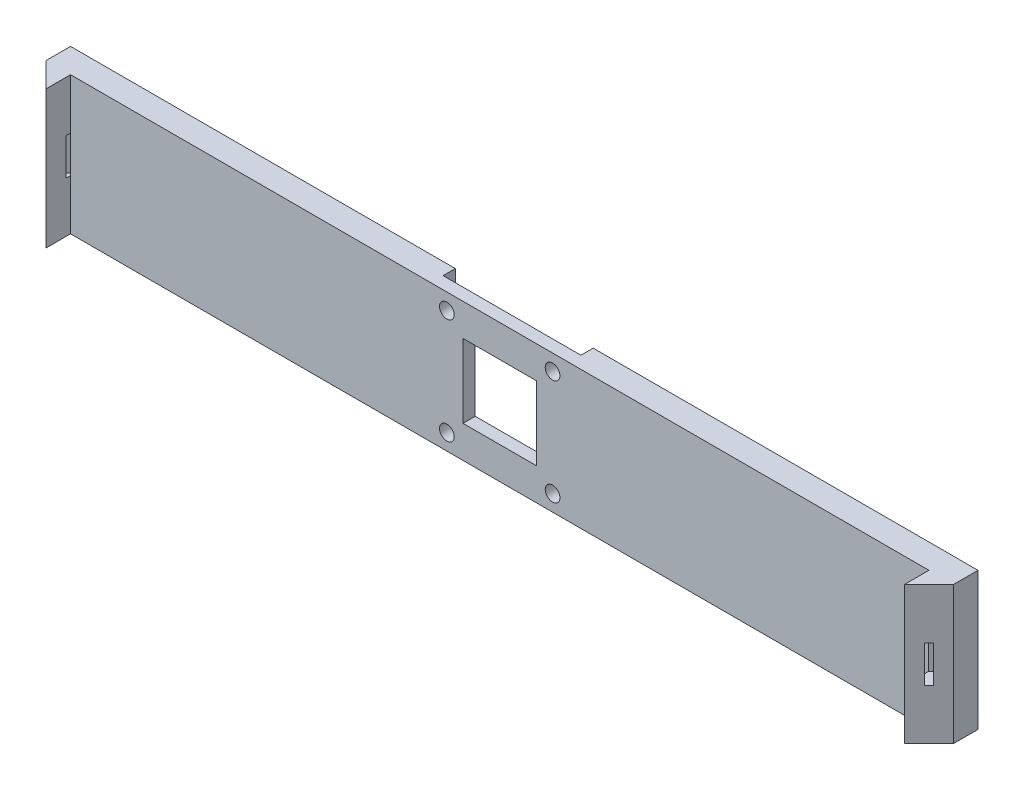
from build123d import *

# Parameters (mm, degrees)
SKETCH1_W           = 350
SKETCH1_H           = 56.2
BOSS_EXTRUDE1_DEPTH = 10
SKETCH2_W           = 56.2
SKETCH2_H           = 56.2
CUT_EXTRUDE1_DEPTH  = 5
SKETCH3_W           = 10
SKETCH3_H           = 56.2
BOSS_EXTRUDE2_DEPTH = 10
SKETCH4_W           = 10
SKETCH4_H           = 56.2
BOSS_EXTRUDE3_DEPTH = 10
CUT_EXTRUDE2_DEPTH  = 56.2
SKETCH6_W           = 10
SKETCH6_H           = 56.2
BOSS_EXTRUDE4_DEPTH = 10
SKETCH7_W           = 10
SKETCH7_H           = 56.2
BOSS_EXTRUDE5_DEPTH = 10
CUT_EXTRUDE3_DEPTH  = 56.2
SKETCH9_W           = 30
SKETCH9_H           = 30
CUT_EXTRUDE4_DEPTH  = 5
SKETCH10_R          = 3
CUT_EXTRUDE5_DEPTH  = 5
SKETCH11_W          = 2.5
SKETCH11_H          = 15
CUT_EXTRUDE6_DEPTH  = 7
SKETCH12_W          = 2.5
SKETCH12_H          = 15
CUT_EXTRUDE8_DEPTH  = 7
BOSS_EXTRUDE7_START = 5
SKETCH14_W          = 56.2
SKETCH14_H          = 56.2
SKETCH14_R          = 3
SKETCH14_W_2        = 30
SKETCH14_H_2        = 30
BOSS_EXTRUDE7_DEPTH = 5
SKETCH15_W          = 56.2
SKETCH15_H          = 56.2
CUT_EXTRUDE9_DEPTH  = 5


with BuildPart() as part:
    # Sketch1 → Boss-Extrude1 (new body)
    with BuildSketch(Plane.XY):
        Rectangle(SKETCH1_W, SKETCH1_H)
    extrude(amount=BOSS_EXTRUDE1_DEPTH)

    # Sketch2 → Cut-Extrude1 (cut)
    with BuildSketch(Plane.XY.offset(10)):
        Rectangle(SKETCH2_W, SKETCH2_H)
    extrude(amount=-CUT_EXTRUDE1_DEPTH, mode=Mode.SUBTRACT)

    # Sketch3 → Boss-Extrude2 (add)
    with BuildSketch(Plane(origin=(175, 0, 0), x_dir=(0, 0, -1), z_dir=(1, 0, 0))):
        with Locations((-5, 0)):
            Rectangle(SKETCH3_W, SKETCH3_H)
    extrude(amount=BOSS_EXTRUDE2_DEPTH)

    # Sketch4 → Boss-Extrude3 (add)
    with BuildSketch(Plane.XY.offset(10)):
        with Locations((180, 0)):
            Rectangle(SKETCH4_W, SKETCH4_H)
    extrude(amount=BOSS_EXTRUDE3_DEPTH)

    # Sketch5 → Cut-Extrude2 (cut)
    with BuildSketch(Plane(origin=(0, 28.1, 0), x_dir=(1, 0, 0), z_dir=(0, 1, 0))):
        Polygon((175, -20), (185, -10), (185, -20), align=None)
    extrude(amount=-CUT_EXTRUDE2_DEPTH, mode=Mode.SUBTRACT)

    # Sketch6 → Boss-Extrude4 (add)
    with BuildSketch(Plane.ZY.offset(175)):
        with Locations((5, 0)):
            Rectangle(SKETCH6_W, SKETCH6_H)
    extrude(amount=BOSS_EXTRUDE4_DEPTH)

    # Sketch7 → Boss-Extrude5 (add)
    with BuildSketch(Plane.XY.offset(10)):
        with Locations((-180, 0)):
            Rectangle(SKETCH7_W, SKETCH7_H)
    extrude(amount=BOSS_EXTRUDE5_DEPTH)

    # Sketch8 → Cut-Extrude3 (cut)
    with BuildSketch(Plane(origin=(0, 28.1, 0), x_dir=(1, 0, 0), z_dir=(0, 1, 0))):
        Polygon((-175, -20), (-185, -10), (-185, -20), align=None)
    extrude(amount=-CUT_EXTRUDE3_DEPTH, mode=Mode.SUBTRACT)

    # Sketch9 → Cut-Extrude4 (cut)
    with BuildSketch(Plane.XY.offset(5)):
        Rectangle(SKETCH9_W, SKETCH9_H)
    extrude(amount=-CUT_EXTRUDE4_DEPTH, mode=Mode.SUBTRACT)

    # Sketch10 → Cut-Extrude5 (cut)
    with BuildSketch(Plane.XY.offset(5)):
        with Locations((21.55, 21.55)):
            Circle(SKETCH10_R)
        with Locations((-21.55, -21.55)):
            Circle(SKETCH10_R)
        with Locations((-21.55, 21.55)):
            Circle(SKETCH10_R)
        with Locations((21.55, -21.55)):
            Circle(SKETCH10_R)
    extrude(amount=-CUT_EXTRUDE5_DEPTH, mode=Mode.SUBTRACT)

    # Sketch11 → Cut-Extrude6 (cut)
    with BuildSketch(Plane(origin=(97.5, 0, 97.5), x_dir=(0.7071067811865478, 0, -0.7071067811865472), z_dir=(0.7071067811865472, 0, 0.7071067811865478))):
        with Locations((116.672618896, 0)):
            Rectangle(SKETCH11_W, SKETCH11_H)
    extrude(amount=-CUT_EXTRUDE6_DEPTH, mode=Mode.SUBTRACT)

    # Sketch12 → Cut-Extrude8 (cut)
    with BuildSketch(Plane(origin=(-97.5, 0, 97.5), x_dir=(0.7071067811865478, 0, 0.7071067811865472), z_dir=(-0.7071067811865472, 0, 0.7071067811865478))):
        with Locations((-116.672618896, 0)):
            Rectangle(SKETCH12_W, SKETCH12_H)
    extrude(amount=-CUT_EXTRUDE8_DEPTH, mode=Mode.SUBTRACT)

    # Sketch14 → Boss-Extrude7 (add)
    with BuildSketch(Plane.XY.offset(5).offset(BOSS_EXTRUDE7_START)):
        Rectangle(SKETCH14_W, SKETCH14_H)
        with Locations((-21.55, 21.55)):
            Circle(SKETCH14_R, mode=Mode.SUBTRACT)
        with Locations((21.55, 21.55)):
            Circle(SKETCH14_R, mode=Mode.SUBTRACT)
        with Locations((21.55, -21.55)):
            Circle(SKETCH14_R, mode=Mode.SUBTRACT)
        with Locations((-21.55, -21.55)):
            Circle(SKETCH14_R, mode=Mode.SUBTRACT)
        Rectangle(SKETCH14_W_2, SKETCH14_H_2, mode=Mode.SUBTRACT)
    extrude(amount=-BOSS_EXTRUDE7_DEPTH)

    # Sketch15 → Cut-Extrude9 (cut)
    with BuildSketch(Plane(origin=(0, 0, 0), x_dir=(-1, 0, 0), z_dir=(0, 0, -1))):
        Rectangle(SKETCH15_W, SKETCH15_H)
    extrude(amount=-CUT_EXTRUDE9_DEPTH, mode=Mode.SUBTRACT)


solid = part.part
